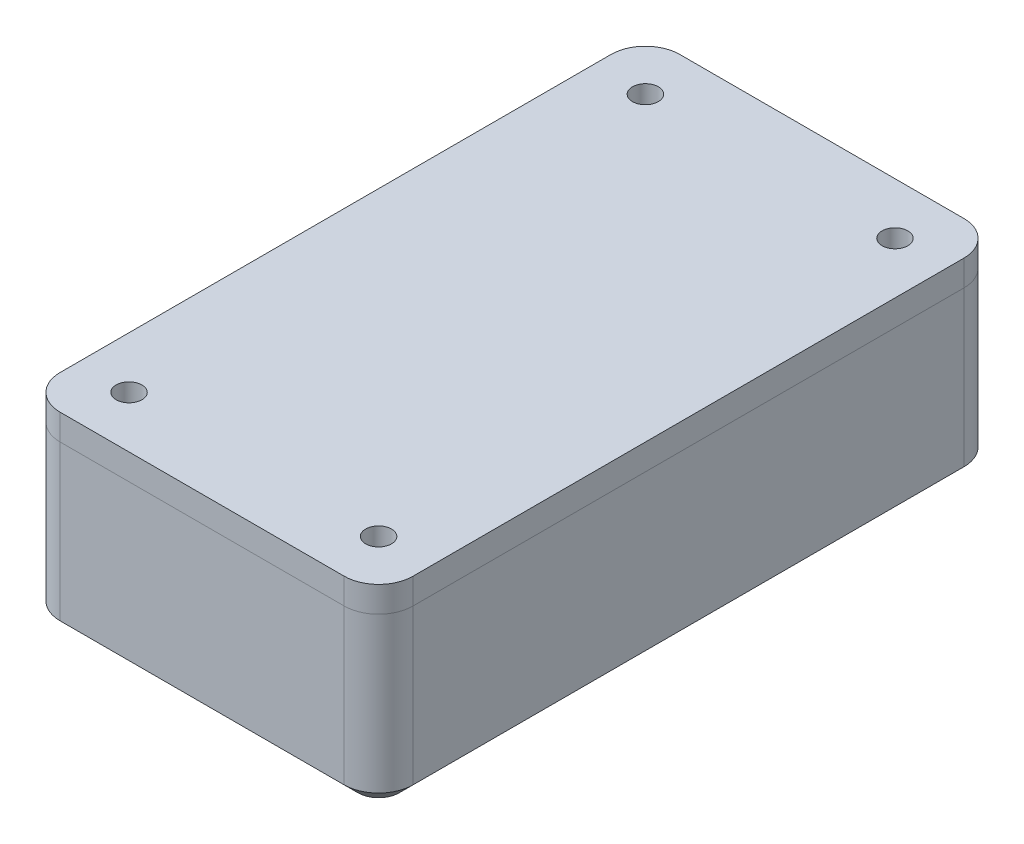
from build123d import *

# Parameters (mm, degrees)
SKETCH1_W           = 41
SKETCH1_H           = 72
SKETCH1_R           = 1.5
BOSS_EXTRUDE1_DEPTH = 2
SKETCH2_W           = 41
SKETCH2_H           = 72
SKETCH2_R           = 1.5
BOSS_EXTRUDE2_DEPTH = 4
SKETCH4_W           = 41
SKETCH4_H           = 72
SKETCH4_W_2         = 37
SKETCH4_H_2         = 68
BOSS_EXTRUDE3_DEPTH = 13.6
FILLET1_START       = 1
FILLET1_DEPTH       = 5
CHAMFER1_SIZE       = 1.6
SKETCH5_W           = 18
SKETCH5_H           = 12.6
CUT_EXTRUDE1_DEPTH  = 76.527544644
SKETCH6_W           = 41
SKETCH6_H           = 72
SKETCH6_R           = 1.5
BOSS_EXTRUDE4_DEPTH = 3
FILLET3_R           = 2
FILLET4_R           = 2
FILLET5_R           = 4
FILLET6_R           = 4
CHAMFER2_SIZE       = 1.6


with BuildPart() as part:
    # Sketch1 → Boss-Extrude1 (new body)
    with BuildSketch(Plane(origin=(0, 0, 0), x_dir=(1, 0, 0), z_dir=(0, 1, 0))):
        Rectangle(SKETCH1_W, SKETCH1_H)
        with Locations(Location((-14.5, 30, 0), (0, 0, 270))):
            Circle(SKETCH1_R, mode=Mode.SUBTRACT)
        with Locations(Location((14.5, 30, 0), (0, 0, 270))):
            Circle(SKETCH1_R, mode=Mode.SUBTRACT)
        with Locations(Location((14.5, -30, 0), (0, 0, 270))):
            Circle(SKETCH1_R, mode=Mode.SUBTRACT)
        with Locations(Location((-14.5, -30, 0), (0, 0, 270))):
            Circle(SKETCH1_R, mode=Mode.SUBTRACT)
    extrude(amount=BOSS_EXTRUDE1_DEPTH)

    # Sketch2 → Boss-Extrude2 (add)
    with BuildSketch(Plane(origin=(0, 2, 0), x_dir=(1, 0, 0), z_dir=(0, 1, 0))):
        Rectangle(SKETCH2_W, SKETCH2_H)
        with Locations(Location((14.5, -30, 0), (0, 0, 270))):
            Circle(SKETCH2_R, mode=Mode.SUBTRACT)
        with Locations(Location((14.5, 30, 0), (0, 0, 270))):
            Circle(SKETCH2_R, mode=Mode.SUBTRACT)
        with Locations(Location((-14.5, 30, 0), (0, 0, 270))):
            Circle(SKETCH2_R, mode=Mode.SUBTRACT)
        with Locations(Location((-14.5, -30, 0), (0, 0, 270))):
            Circle(SKETCH2_R, mode=Mode.SUBTRACT)
        with BuildLine():
            Line((-14.5, 34), (14.5, 34))
            ThreePointArc((14.5, 34), (11.671572875, 27.171572875), (18.5, 30))
            Line((18.5, 30), (18.5, -30))
            ThreePointArc((18.5, -30), (11.671572875, -27.171572875), (14.5, -34))
            Line((14.5, -34), (-14.5, -34))
            ThreePointArc((-14.5, -34), (-11.671572875, -27.171572875), (-18.5, -30))
            Line((-18.5, -30), (-18.5, 30))
            ThreePointArc((-18.5, 30), (-11.671572875, 27.171572875), (-14.5, 34))
        make_face(mode=Mode.SUBTRACT)
    extrude(amount=BOSS_EXTRUDE2_DEPTH)

    # Sketch4 → Boss-Extrude3 (add)
    with BuildSketch(Plane(origin=(0, 6, 0), x_dir=(1, 0, 0), z_dir=(0, 1, 0))):
        Rectangle(SKETCH4_W, SKETCH4_H)
        Rectangle(SKETCH4_W_2, SKETCH4_H_2, mode=Mode.SUBTRACT)
    extrude(amount=BOSS_EXTRUDE3_DEPTH)

    # Fillet1: read off the stored shape, not the designer's step
    # Fillet1 outline → Fillet1 (add)
    with BuildSketch(Plane(origin=(0, 0, 0), x_dir=(1, 0, 0), z_dir=(0, 1, 0)).offset(FILLET1_START)):
        with BuildLine():
            Line((-14.5, -34), (-8.843145751, -34))
            ThreePointArc((-8.843145751, -34), (-10.476138912, -33.154700538), (-10.728763834, -31.333333333))
            ThreePointArc((-10.728763834, -31.333333333), (-12.190598923, -33.265986324), (-14.5, -34))
        make_face()
        with BuildLine():
            ThreePointArc((10.728763834, -31.333333333), (10.476138912, -33.154700538), (8.843145751, -34))
            Line((8.843145751, -34), (14.5, -34))
            ThreePointArc((14.5, -34), (12.190598923, -33.265986324), (10.728763834, -31.333333333))
        make_face()
        with BuildLine():
            ThreePointArc((-18.5, -30), (-17.765986324, -27.690598923), (-15.833333333, -26.228763833))
            ThreePointArc((-15.833333333, -26.228763833), (-17.654700538, -25.976138912), (-18.5, -24.343145751))
            Line((-18.5, -24.343145751), (-18.5, -30))
        make_face()
        with BuildLine():
            ThreePointArc((18.5, -24.343145751), (17.654700538, -25.976138912), (15.833333333, -26.228763834))
            ThreePointArc((15.833333333, -26.228763834), (17.765986324, -27.690598923), (18.5, -30))
            Line((18.5, -30), (18.5, -24.343145751))
        make_face()
        with BuildLine():
            Line((-18.5, 30), (-18.5, 24.343145751))
            ThreePointArc((-18.5, 24.343145751), (-17.654700538, 25.976138912), (-15.833333333, 26.228763834))
            ThreePointArc((-15.833333333, 26.228763834), (-17.765986324, 27.690598923), (-18.5, 30))
        make_face()
        with BuildLine():
            ThreePointArc((15.833333333, 26.228763834), (17.654700538, 25.976138912), (18.5, 24.343145751))
            Line((18.5, 24.343145751), (18.5, 30))
            ThreePointArc((18.5, 30), (17.765986324, 27.690598923), (15.833333333, 26.228763834))
        make_face()
        with BuildLine():
            ThreePointArc((-14.5, 34), (-12.190598923, 33.265986324), (-10.728763833, 31.333333333))
            ThreePointArc((-10.728763833, 31.333333333), (-10.476138912, 33.154700538), (-8.843145751, 34))
            Line((-8.843145751, 34), (-14.5, 34))
        make_face()
        with BuildLine():
            ThreePointArc((8.843145751, 34), (10.476138912, 33.154700538), (10.728763834, 31.333333333))
            ThreePointArc((10.728763834, 31.333333333), (12.190598923, 33.265986324), (14.5, 34))
            Line((14.5, 34), (8.843145751, 34))
        make_face()
    extrude(amount=FILLET1_DEPTH)

    # Chamfer1
    # the kernel refuses this chamfer: 1.6 mm, written as the material it takes off along each edge
    with BuildSketch(Plane(origin=(14.5, 6, 30), x_dir=(0.33333333328504766, 0, -0.9428090415991349), z_dir=(0.9428090415991349, 0, 0.33333333328504766))) as chamfer1_piece_1:
        Polygon((4 - CHAMFER1_SIZE, 0), (4, -CHAMFER1_SIZE), (4, 0), align=None)
    revolve(axis=Axis((14.5, 6, 30), (0, 1, 0)), revolution_arc=128.942441263, mode=Mode.SUBTRACT)
    with BuildSketch(Plane(origin=(14.5, 6, -30), x_dir=(-0.9428090415991346, 0, -0.33333333328504894), z_dir=(0.33333333328504894, 0, -0.9428090415991346))) as chamfer1_piece_2:
        Polygon((4 - CHAMFER1_SIZE, 0), (4, -CHAMFER1_SIZE), (4, 0), align=None)
    revolve(axis=Axis((14.5, 6, -30), (0, 1, 0)), revolution_arc=128.942441263, mode=Mode.SUBTRACT)
    with BuildSketch(Plane(origin=(-14.5, 6, -30), x_dir=(-0.33333333328504905, 0, 0.9428090415991345), z_dir=(-0.9428090415991345, 0, -0.33333333328504905))) as chamfer1_piece_3:
        Polygon((4, -CHAMFER1_SIZE), (4 - CHAMFER1_SIZE, 0), (4, 0), align=None)
    revolve(axis=Axis((-14.5, 6, -30), (0, 1, 0)), revolution_arc=128.942441258, mode=Mode.SUBTRACT)
    with BuildSketch(Plane(origin=(-8.843145749, 6, 31.999999999), x_dir=(0.8833787709111521, 0, -0.4686597348860923), z_dir=(-0.4686597348860923, 0, -0.8833787709111521))) as chamfer1_piece_4_section:
        Polygon((2.000000001 + CHAMFER1_SIZE, 0), (2.000000001, CHAMFER1_SIZE), (2.000000001, 0), align=None)
    chamfer1_piece_4 = revolve(axis=Axis((-8.843145749, 6, 31.999999999), (0, -1, 0)), revolution_arc=227.418552742, mode=Mode.PRIVATE)
    chamfer1_piece_4 = split(chamfer1_piece_4, bisect_by=Plane(origin=(-8.843145749, 6, 34), z_dir=(0, 0, -1)), keep=Keep.TOP, mode=Mode.PRIVATE)
    add(chamfer1_piece_4, mode=Mode.SUBTRACT)
    with BuildSketch(Plane(origin=(-16.5, 6, 24.34314575), x_dir=(0.3333333334424864, 0, 0.942809041543472), z_dir=(0.942809041543472, 0, -0.3333333334424864))) as chamfer1_piece_5_section:
        Polygon((2 + CHAMFER1_SIZE, 0), (2, CHAMFER1_SIZE), (2, 0), align=None)
    chamfer1_piece_5 = revolve(axis=Axis((-16.5, 6, 24.34314575), (0, -1, 0)), revolution_arc=227.41855287, mode=Mode.PRIVATE)
    chamfer1_piece_5 = split(chamfer1_piece_5, bisect_by=Plane(origin=(-18.5, 6, 24.34314575), z_dir=(1, 0, 0)), keep=Keep.TOP, mode=Mode.PRIVATE)
    add(chamfer1_piece_5, mode=Mode.SUBTRACT)
    with BuildSketch(Plane(origin=(8.843145749, 6, 31.999999999), x_dir=(0.9428090418063638, 0, -0.3333333326989159), z_dir=(-0.3333333326989159, 0, -0.9428090418063638))) as chamfer1_piece_6_section:
        Polygon((2.000000001 + CHAMFER1_SIZE, 0), (2.000000001, CHAMFER1_SIZE), (2.000000001, 0), align=None)
    chamfer1_piece_6 = revolve(axis=Axis((8.843145749, 6, 31.999999999), (0, -1, 0)), revolution_arc=227.418552742, mode=Mode.PRIVATE)
    chamfer1_piece_6 = split(chamfer1_piece_6, bisect_by=Plane(origin=(8.843145749, 6, 34), z_dir=(0, 0, -1)), keep=Keep.TOP, mode=Mode.PRIVATE)
    add(chamfer1_piece_6, mode=Mode.SUBTRACT)
    with BuildSketch(Plane(origin=(16.499999999, 6, 24.343145749), x_dir=(-0.4686597348860955, 0, -0.8833787709111505), z_dir=(-0.8833787709111505, 0, 0.4686597348860955))) as chamfer1_piece_7_section:
        Polygon((2.000000001 + CHAMFER1_SIZE, 0), (2.000000001, CHAMFER1_SIZE), (2.000000001, 0), align=None)
    chamfer1_piece_7 = revolve(axis=Axis((16.499999999, 6, 24.343145749), (0, -1, 0)), revolution_arc=227.418552742, mode=Mode.PRIVATE)
    chamfer1_piece_7 = split(chamfer1_piece_7, bisect_by=Plane(origin=(18.5, 6, 24.343145749), z_dir=(-1, 0, 0)), keep=Keep.TOP, mode=Mode.PRIVATE)
    add(chamfer1_piece_7, mode=Mode.SUBTRACT)
    with BuildSketch(Plane(origin=(8.843145749, 6, -31.999999999), x_dir=(-0.8833787709111521, 0, 0.4686597348860923), z_dir=(0.4686597348860923, 0, 0.8833787709111521))) as chamfer1_piece_8_section:
        Polygon((2.000000001 + CHAMFER1_SIZE, 0), (2.000000001, CHAMFER1_SIZE), (2.000000001, 0), align=None)
    chamfer1_piece_8 = revolve(axis=Axis((8.843145749, 6, -31.999999999), (0, -1, 0)), revolution_arc=227.418552742, mode=Mode.PRIVATE)
    chamfer1_piece_8 = split(chamfer1_piece_8, bisect_by=Plane(origin=(8.843145749, 6, -34), z_dir=(0, 0, 1)), keep=Keep.TOP, mode=Mode.PRIVATE)
    add(chamfer1_piece_8, mode=Mode.SUBTRACT)
    with BuildSketch(Plane(origin=(16.499999999, 6, -24.343145749), x_dir=(-0.3333333326989176, 0, -0.9428090418063633), z_dir=(-0.9428090418063633, 0, 0.3333333326989176))) as chamfer1_piece_9_section:
        Polygon((2.000000001 + CHAMFER1_SIZE, 0), (2.000000001, CHAMFER1_SIZE), (2.000000001, 0), align=None)
    chamfer1_piece_9 = revolve(axis=Axis((16.499999999, 6, -24.343145749), (0, -1, 0)), revolution_arc=227.418552742, mode=Mode.PRIVATE)
    chamfer1_piece_9 = split(chamfer1_piece_9, bisect_by=Plane(origin=(18.5, 6, -24.343145749), z_dir=(-1, 0, 0)), keep=Keep.TOP, mode=Mode.PRIVATE)
    add(chamfer1_piece_9, mode=Mode.SUBTRACT)
    with BuildSketch(Plane(origin=(-8.84314575, 6, -32), x_dir=(-0.9428090415434718, 0, 0.3333333334424869), z_dir=(0.3333333334424869, 0, 0.9428090415434718))) as chamfer1_piece_10_section:
        Polygon((2 + CHAMFER1_SIZE, 0), (2, CHAMFER1_SIZE), (2, 0), align=None)
    chamfer1_piece_10 = revolve(axis=Axis((-8.84314575, 6, -32), (0, -1, 0)), revolution_arc=227.41855287, mode=Mode.PRIVATE)
    chamfer1_piece_10 = split(chamfer1_piece_10, bisect_by=Plane(origin=(-8.84314575, 6, -34), z_dir=(0, 0, 1)), keep=Keep.TOP, mode=Mode.PRIVATE)
    add(chamfer1_piece_10, mode=Mode.SUBTRACT)
    with BuildSketch(Plane(origin=(-16.499999999, 6, -24.343145749), x_dir=(0.4686597348860955, 0, 0.8833787709111505), z_dir=(0.8833787709111505, 0, -0.4686597348860955))) as chamfer1_piece_11_section:
        Polygon((2.000000001 + CHAMFER1_SIZE, 0), (2.000000001, CHAMFER1_SIZE), (2.000000001, 0), align=None)
    chamfer1_piece_11 = revolve(axis=Axis((-16.499999999, 6, -24.343145749), (0, -1, 0)), revolution_arc=227.418552742, mode=Mode.PRIVATE)
    chamfer1_piece_11 = split(chamfer1_piece_11, bisect_by=Plane(origin=(-18.5, 6, -24.343145749), z_dir=(1, 0, 0)), keep=Keep.TOP, mode=Mode.PRIVATE)
    add(chamfer1_piece_11, mode=Mode.SUBTRACT)
    with BuildSketch(Plane(origin=(-14.5, 6, 30), x_dir=(0.9428090415991349, 0, 0.33333333328504766), z_dir=(-0.33333333328504766, 0, 0.9428090415991349))) as chamfer1_piece_12:
        Polygon((4 - CHAMFER1_SIZE, 0), (4, -CHAMFER1_SIZE), (4, 0), align=None)
    revolve(axis=Axis((-14.5, 6, 30), (0, 1, 0)), revolution_arc=128.942441258, mode=Mode.SUBTRACT)

    # Sketch5 → Cut-Extrude1 (cut, through all)
    with BuildSketch(Plane.XY.offset(-34)):
        with Locations((0, 13.3)):
            Rectangle(SKETCH5_W, SKETCH5_H)
    extrude(amount=-CUT_EXTRUDE1_DEPTH, mode=Mode.SUBTRACT)

    # Fillet3
    fillet3_edges = [part.edges().sort_by_distance(p)[0] for p in [
        (-11.671572875, 2, 27.171572875),
        (0, 2, -34),
        (-11.671572875, 2, -27.171572875),
        (-18.5, 2, 0),
        (0, 2, 34),
        (11.671572875, 2, 27.171572875),
        (18.5, 2, 0),
        (11.671572875, 2, -27.171572875),
        (-17.654700538, 2, -25.976138912),
        (-10.476138912, 2, -33.154700538),
        (17.654700538, 2, -25.976138912),
        (10.476138912, 2, -33.154700538),
        (17.654700538, 2, 25.976138912),
        (10.476138912, 2, 33.154700538),
        (-17.654700538, 2, 25.976138912),
        (-10.476138912, 2, 33.154700538),
    ]]
    fillet(fillet3_edges, radius=FILLET3_R)

    # Fillet4
    fillet4_edges = [part.edges().sort_by_distance(p)[0] for p in [
        (-18.5, 12.8, -34),
        (18.5, 12.8, -34),
        (18.5, 12.8, 34),
        (-18.5, 12.8, 34),
    ]]
    fillet(fillet4_edges, radius=FILLET4_R)

    # Fillet5
    fillet5_edges = [part.edges().sort_by_distance(p)[0] for p in [
        (-20.5, 9.8, 36),
        (-20.5, 9.8, -36),
        (20.5, 9.8, -36),
        (20.5, 9.8, 36),
    ]]
    fillet(fillet5_edges, radius=FILLET5_R)

    # Chamfer2
    chamfer2_edges = [part.edges().sort_by_distance(p)[0] for p in [
        (20.5, 0, 0),
        (0, 0, 36),
        (-20.5, 0, 0),
        (0, 0, -36),
        (19.328427125, 0, -34.828427125),
        (-19.328427125, 0, -34.828427125),
        (-19.328427125, 0, 34.828427125),
        (19.328427125, 0, 34.828427125),
    ]]
    chamfer(chamfer2_edges, length=CHAMFER2_SIZE)


with BuildPart() as body_2:
    # Sketch6 → Boss-Extrude4 (new body)
    with BuildSketch(Plane(origin=(0, 19.6, 0), x_dir=(1, 0, 0), z_dir=(0, 1, 0))):
        Rectangle(SKETCH6_W, SKETCH6_H)
        with Locations(Location((-14.5, -30, 0), (0, 0, 270))):
            Circle(SKETCH6_R, mode=Mode.SUBTRACT)
        with Locations(Location((14.5, -30, 0), (0, 0, 270))):
            Circle(SKETCH6_R, mode=Mode.SUBTRACT)
        with Locations(Location((14.5, 30, 0), (0, 0, 270))):
            Circle(SKETCH6_R, mode=Mode.SUBTRACT)
        with Locations(Location((-14.5, 30, 0), (0, 0, 270))):
            Circle(SKETCH6_R, mode=Mode.SUBTRACT)
    extrude(amount=BOSS_EXTRUDE4_DEPTH)

    # Fillet6
    fillet6_edges = [body_2.edges().sort_by_distance(p)[0] for p in [
        (20.5, 21.1, 36),
        (-20.5, 21.1, 36),
        (-20.5, 21.1, -36),
        (20.5, 21.1, -36),
    ]]
    fillet(fillet6_edges, radius=FILLET6_R)


solid = Compound([part.part, body_2.part])
